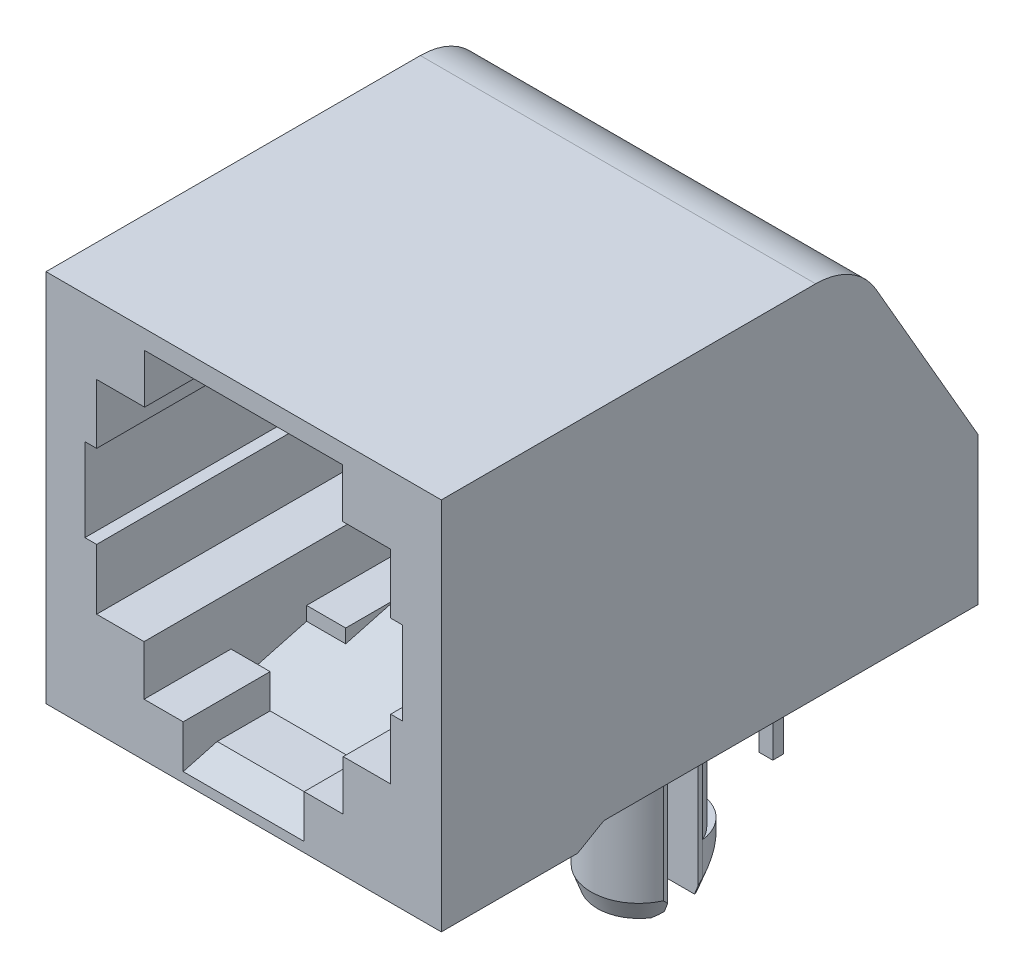
from build123d import *
from OCP.BRepFilletAPI import BRepFilletAPI_MakeChamfer

# Parameters (mm, degrees)
CUT_EXTRUDE1_START       = -5.7785
CUT_EXTRUDE1_OUTLINE_W   = 11.5824
CUT_EXTRUDE1_OUTLINE_H   = 18.034
CUT_EXTRUDE1_DEPTH       = 12.065
CUT_EXTRUDE1_START_2     = -9.7917
CUT_EXTRUDE1_2_DEPTH     = 4.0132
CUT_EXTRUDE1_START_3     = 15.205152132
CUT_EXTRUDE1_3_OUTLINE_W = 11.5824
CUT_EXTRUDE1_3_OUTLINE_H = 11
CUT_EXTRUDE1_3_DEPTH     = 4.794847868
CUT_EXTRUDE2_DEPTH       = 4.064
CUT_EXTRUDE3_DEPTH       = 1.31445
CUT_EXTRUDE4_DEPTH       = 1.31445
SKETCH5_W                = 2.921
SKETCH5_H                = 1.143
CUT_EXTRUDE5_DEPTH       = 4.064
SKETCH6_W                = 6.6929
SKETCH6_H                = 12.7762
CUT_EXTRUDE6_DEPTH       = 2.8194
SKETCH7_W                = 8.28675
SKETCH7_H                = 12.7762
CUT_EXTRUDE7_DEPTH       = 2.3876
SKETCH8_W                = 9.8806
SKETCH8_H                = 12.7762
CUT_EXTRUDE8_DEPTH       = 3.302
SKETCH9_W                = 11.5824
SKETCH9_H                = 5.461
BOSS_EXTRUDE1_DEPTH      = 0.508
BOSS_EXTRUDE2_DEPTH      = 1.7018
SKETCH11_W               = 0.762
SKETCH11_H               = 1.778
CUT_EXTRUDE9_DEPTH       = 0.381
SKETCH12_W               = 0.762
SKETCH12_H               = 1.778
CUT_EXTRUDE10_DEPTH      = 0.381
BOSS_EXTRUDE3_REACH      = 26
BOSS_EXTRUDE4_REACH      = 26
SKETCH15_W               = 1.59385
SKETCH15_H               = 3.5306
CUT_EXTRUDE11_DEPTH      = 9.6774
SKETCH16_W               = 1.59385
SKETCH16_H               = 3.0988
CUT_EXTRUDE12_DEPTH      = 2.3876
SKETCH17_W               = 1.59385
SKETCH17_H               = 1.143
CUT_EXTRUDE13_DEPTH      = 9.6774
BOSS_EXTRUDE5_DEPTH      = 4.2418
SKETCH19_W               = 6.6548
SKETCH19_H               = 4.6736
BOSS_EXTRUDE6_DEPTH      = 1.524
SKETCH20_W               = 6.6548
SKETCH20_H               = 3.3274
CUT_EXTRUDE14_DEPTH      = 1.651
SKETCH21_W               = 9.6774
SKETCH21_H               = 2.794
CUT_EXTRUDE15_DEPTH      = 0.3937
SKETCH22_W               = 9.6774
SKETCH22_H               = 2.794
CUT_EXTRUDE16_DEPTH      = 0.3937
SKETCH23_W               = 0.4572
SKETCH23_H               = 0.3556
BOSS_EXTRUDE7_DEPTH      = 4.318
SKETCH24_W               = 0.4572
SKETCH24_H               = 0.3556
BOSS_EXTRUDE8_DEPTH      = 4.318
SKETCH25_W               = 0.4572
SKETCH25_H               = 0.3556
BOSS_EXTRUDE9_DEPTH      = 4.318
SKETCH26_W               = 0.4572
SKETCH26_H               = 0.3556
BOSS_EXTRUDE10_DEPTH     = 4.318
SKETCH27_W               = 0.4572
SKETCH27_H               = 0.3556
BOSS_EXTRUDE11_DEPTH     = 4.318
SKETCH28_W               = 0.4572
SKETCH28_H               = 0.3556
BOSS_EXTRUDE12_DEPTH     = 4.318
DRAFT1_ANGLE             = 60
RIB1_START               = -0.2286
RIB1_DEPTH               = 0.4572
RIB2_START               = -0.2286
RIB2_DEPTH               = 0.4572
RIB3_START               = -0.2286
RIB3_DEPTH               = 0.4572
RIB4_START               = -0.2286
RIB4_DEPTH               = 0.4572
RIB5_START               = -0.2286
RIB5_DEPTH               = 0.4572
RIB6_START               = -0.2286
RIB6_DEPTH               = 0.4572
CHAMFER1_SIZE            = 0.146646968
CHAMFER1_SIZE2           = 0.254
CHAMFER2_SIZE            = 1.143
CHAMFER2_SIZE2           = 0.306265927
FILLET1_R                = 2.3368


with BuildPart() as part:
    # Cut-Extrude1: read off the stored shape, not the designer's step
    # Cut-Extrude1 outline → Cut-Extrude1 (new body)
    with BuildSketch(Plane(origin=(0, 0, 0), x_dir=(1, 0, 0), z_dir=(0, 1, 0)).offset(CUT_EXTRUDE1_START)):
        with Locations((0.8509, 9.017)):
            Rectangle(CUT_EXTRUDE1_OUTLINE_W, CUT_EXTRUDE1_OUTLINE_H)
    extrude(amount=CUT_EXTRUDE1_DEPTH)

    # Cut-Extrude1 2 outline → Cut-Extrude1 2 (add)
    with BuildSketch(Plane(origin=(0, 0, 0), x_dir=(1, 0, 0), z_dir=(0, 1, 0)).offset(CUT_EXTRUDE1_START_2)):
        with BuildLine():
            Line((-3.6068, 7.6962), (-6.5532, 7.6962))
            Line((-6.5532, 7.6962), (-6.5532, 7.54759649))
            ThreePointArc((-6.5532, 7.54759649), (-5.08, 6.5913), (-3.6068, 7.54759649))
            Line((-3.6068, 7.54759649), (-3.6068, 7.6962))
        make_face()
        with BuildLine():
            ThreePointArc((-3.6068, 8.86080351), (-5.08, 9.8171), (-6.5532, 8.86080351))
            Line((-6.5532, 8.86080351), (-6.5532, 8.7122))
            Line((-6.5532, 8.7122), (-3.6068, 8.7122))
            Line((-3.6068, 8.7122), (-3.6068, 8.86080351))
        make_face()
        with BuildLine():
            Line((3.6068, 8.86080351), (3.6068, 8.7122))
            Line((3.6068, 8.7122), (6.5532, 8.7122))
            Line((6.5532, 8.7122), (6.5532, 8.86080351))
            ThreePointArc((6.5532, 8.86080351), (5.08, 9.8171), (3.6068, 8.86080351))
        make_face()
        with BuildLine():
            Line((6.5532, 7.54759649), (6.5532, 7.6962))
            Line((6.5532, 7.6962), (3.6068, 7.6962))
            Line((3.6068, 7.6962), (3.6068, 7.54759649))
            ThreePointArc((3.6068, 7.54759649), (5.08, 6.5913), (6.5532, 7.54759649))
        make_face()
    extrude(amount=CUT_EXTRUDE1_2_DEPTH)

    # Cut-Extrude1 3 outline → Cut-Extrude1 3 (cut)
    with BuildSketch(Plane(origin=(0, 0, 0), x_dir=(1, 0, 0), z_dir=(0, 0.500000000000017, -0.8660254037844289)).offset(CUT_EXTRUDE1_START_3)):
        with Locations((0.8509, 5.5)):
            Rectangle(CUT_EXTRUDE1_3_OUTLINE_W, CUT_EXTRUDE1_3_OUTLINE_H)
    extrude(amount=CUT_EXTRUDE1_3_DEPTH, mode=Mode.SUBTRACT)

    # Cut-Extrude1 4 outline → Cut-Extrude1 4 (revolve, cut)
    with BuildSketch(Plane(origin=(5.08, 0, -8.2042), x_dir=(1, 0, 0), z_dir=(0, 0, 1))):
        Polygon((1.6129, -9.198519625), (1.396999946, -9.791700147), (1.6129, -9.791700147), align=None)
    revolve(axis=Axis((5.08, 0, -8.2042), (0, 1, 0)), mode=Mode.SUBTRACT)

    # Cut-Extrude1 5 outline → Cut-Extrude1 5 (revolve, cut)
    with BuildSketch(Plane(origin=(-5.08, 0, -8.2042), x_dir=(1, 0, 0), z_dir=(0, 0, 1))):
        Polygon((1.6129, -9.198519625), (1.396999946, -9.791700147), (1.6129, -9.791700147), align=None)
    revolve(axis=Axis((-5.08, 0, -8.2042), (0, 1, 0)), mode=Mode.SUBTRACT)

    # Sketch2 → Cut-Extrude2 (cut)
    with BuildSketch(Plane(origin=(2.032, 0, 0), x_dir=(0, 0, -1), z_dir=(1, 0, 0))):
        Polygon((7.186734073, -4.5085), (2.921, -4.5085), (2.921, -5.6515), align=None)
    extrude(amount=-CUT_EXTRUDE2_DEPTH, mode=Mode.SUBTRACT)

    # Sketch3 → Cut-Extrude3 (cut)
    with BuildSketch(Plane.ZY.offset(-2.032)):
        Polygon((-2.921, -4.5085), (-5.461, -4.5085), (-5.461, -4.970909051), (-2.921, -5.6515), align=None)
    extrude(amount=-CUT_EXTRUDE3_DEPTH, mode=Mode.SUBTRACT)

    # Sketch4 → Cut-Extrude4 (cut)
    with BuildSketch(Plane(origin=(-2.032, 0, 0), x_dir=(0, 0, -1), z_dir=(1, 0, 0))):
        Polygon((5.461, -4.5085), (2.921, -4.5085), (2.921, -5.6515), (5.461, -4.970909051), align=None)
    extrude(amount=-CUT_EXTRUDE4_DEPTH, mode=Mode.SUBTRACT)

    # Sketch5 → Cut-Extrude5 (cut)
    with BuildSketch(Plane(origin=(2.032, 0, 0), x_dir=(0, 0, -1), z_dir=(1, 0, 0))):
        with Locations((1.4605, -5.08)):
            Rectangle(SKETCH5_W, SKETCH5_H)
    extrude(amount=-CUT_EXTRUDE5_DEPTH, mode=Mode.SUBTRACT)

    # Sketch6 → Cut-Extrude6 (cut)
    with BuildSketch(Plane.XZ.offset(4.5085)):
        with Locations((0, -6.3881)):
            Rectangle(SKETCH6_W, SKETCH6_H)
    extrude(amount=-CUT_EXTRUDE6_DEPTH, mode=Mode.SUBTRACT)

    # Sketch7 → Cut-Extrude7 (cut)
    with BuildSketch(Plane.XZ.offset(1.6891)):
        with Locations((-0.796925, -6.3881)):
            Rectangle(SKETCH7_W, SKETCH7_H)
    extrude(amount=-CUT_EXTRUDE7_DEPTH, mode=Mode.SUBTRACT)

    # Sketch8 → Cut-Extrude8 (cut)
    with BuildSketch(Plane.XZ.offset(-0.6985)):
        with Locations((0, -6.3881)):
            Rectangle(SKETCH8_W, SKETCH8_H)
    extrude(amount=-CUT_EXTRUDE8_DEPTH, mode=Mode.SUBTRACT)

    # Sketch9 → Boss-Extrude1 (add)
    with BuildSketch(Plane.XZ.offset(5.7785)):
        with Locations((0.8509, -2.7305)):
            Rectangle(SKETCH9_W, SKETCH9_H)
    extrude(amount=BOSS_EXTRUDE1_DEPTH)

    # Sketch10 → Boss-Extrude2 (add)
    with BuildSketch(Plane.ZY.offset(4.9403)):
        Polygon((0, -6.2865), (-5.461, -6.2865), (-5.461, -5.7785), (-18.034, -5.7785), (-18.034, -0.8255), (-13.927884886, 6.2865), (0, 6.2865), align=None)
    extrude(amount=BOSS_EXTRUDE2_DEPTH)

    # Sketch11 → Cut-Extrude9 (cut)
    with BuildSketch(Plane.XY.offset(-12.7762)):
        with Locations((4.5593, 1.5875)):
            Rectangle(SKETCH11_W, SKETCH11_H)
    extrude(amount=-CUT_EXTRUDE9_DEPTH, mode=Mode.SUBTRACT)

    # Sketch12 → Cut-Extrude10 (cut)
    with BuildSketch(Plane.XY.offset(-12.7762)):
        with Locations((-4.5593, 1.5875)):
            Rectangle(SKETCH12_W, SKETCH12_H)
    extrude(amount=-CUT_EXTRUDE10_DEPTH, mode=Mode.SUBTRACT)

    # Boss-Extrude3: up to this cone (the profile starts inside it)
    boss_extrude3_end = Plane(origin=(5.08, -8.0899, -8.2042), z_dir=(0, 1, 0)).offset(-5.540024955) * Cone(1e-06, 12.395526987, 34.0564295, align=(Align.CENTER, Align.CENTER, Align.MIN), mode=Mode.PRIVATE)
    # Sketch13 → Boss-Extrude3 (add, up to the surface)
    with BuildSketch(Plane(origin=(0, -8.0899, 0), x_dir=(1, 0, 0), z_dir=(0, 1, 0)), mode=Mode.PRIVATE) as boss_extrude3_sk1:
        with BuildLine():
            ThreePointArc((6.543319155, 8.88253875), (5.08, 10.1854), (3.616680845, 8.88253875))
            ThreePointArc((3.616680845, 8.88253875), (5.08, 9.8171), (6.543319155, 8.88253875))
        make_face()
    boss_extrude3_tool1 = extrude(boss_extrude3_sk1.sketch, amount=-BOSS_EXTRUDE3_REACH, mode=Mode.PRIVATE) & boss_extrude3_end
    add(boss_extrude3_tool1.solids().sort_by_distance((5.08, -8.0899, -10.153365))[0])

    # Boss-Extrude4: up to this cone (the profile starts inside it)
    boss_extrude4_end = Plane(origin=(-5.08, -8.0899, -8.2042), z_dir=(0, 1, 0)).offset(-5.540024955) * Cone(1e-06, 12.395526987, 34.0564295, align=(Align.CENTER, Align.CENTER, Align.MIN), mode=Mode.PRIVATE)
    # Sketch14 → Boss-Extrude4 (add, up to the surface)
    with BuildSketch(Plane(origin=(0, -8.0899, 0), x_dir=(1, 0, 0), z_dir=(0, 1, 0)), mode=Mode.PRIVATE) as boss_extrude4_sk1:
        with BuildLine():
            ThreePointArc((-6.543319155, 8.88253875), (-5.08, 9.8171), (-3.616680845, 8.88253875))
            ThreePointArc((-3.616680845, 8.88253875), (-5.08, 10.1854), (-6.543319155, 8.88253875))
        make_face()
    boss_extrude4_tool1 = extrude(boss_extrude4_sk1.sketch, amount=-BOSS_EXTRUDE4_REACH, mode=Mode.PRIVATE) & boss_extrude4_end
    add(boss_extrude4_tool1.solids().sort_by_distance((-5.08, -8.0899, -10.153365))[0])

    # Sketch15 → Cut-Extrude11 (cut)
    with BuildSketch(Plane.XY):
        with Locations((4.143375, -1.0668)):
            Rectangle(SKETCH15_W, SKETCH15_H)
    extrude(amount=-CUT_EXTRUDE11_DEPTH, mode=Mode.SUBTRACT)

    # Sketch16 → Cut-Extrude12 (cut)
    with BuildSketch(Plane(origin=(0, 0.6985, 0), x_dir=(-1, 0, 0), z_dir=(0, 1, 0))):
        with Locations((-4.143375, -11.2268)):
            Rectangle(SKETCH16_W, SKETCH16_H)
    extrude(amount=-CUT_EXTRUDE12_DEPTH, mode=Mode.SUBTRACT)

    # Sketch17 → Cut-Extrude13 (cut)
    with BuildSketch(Plane.XY):
        with Locations((-4.143375, -2.2606)):
            Rectangle(SKETCH17_W, SKETCH17_H)
    extrude(amount=-CUT_EXTRUDE13_DEPTH, mode=Mode.SUBTRACT)

    # Sketch18 → Boss-Extrude5 (add)
    with BuildSketch(Plane.XY.offset(-8.7122)):
        with BuildLine():
            Line((0.508, -5.7785), (-0.508, -5.7785))
            ThreePointArc((-0.508, -5.7785), (0, -6.2865), (0.508, -5.7785))
        make_face()
    extrude(amount=-BOSS_EXTRUDE5_DEPTH)

    # Sketch19 → Boss-Extrude6 (add)
    with BuildSketch(Plane.XY.offset(-12.7762)):
        with Locations((0, 1.6637)):
            Rectangle(SKETCH19_W, SKETCH19_H)
    extrude(amount=BOSS_EXTRUDE6_DEPTH)

    # Sketch20 → Cut-Extrude14 (cut)
    with BuildSketch(Plane.XZ.offset(-4.0005)):
        with Locations((0, -1.6637)):
            Rectangle(SKETCH20_W, SKETCH20_H)
    extrude(amount=-CUT_EXTRUDE14_DEPTH, mode=Mode.SUBTRACT)

    # Sketch21 → Cut-Extrude15 (cut)
    with BuildSketch(Plane.ZY.offset(-4.9403)):
        with Locations((-4.8387, 0.5969)):
            Rectangle(SKETCH21_W, SKETCH21_H)
    extrude(amount=-CUT_EXTRUDE15_DEPTH, mode=Mode.SUBTRACT)

    # Sketch22 → Cut-Extrude16 (cut)
    with BuildSketch(Plane(origin=(-4.9403, 0, 0), x_dir=(0, 0, -1), z_dir=(1, 0, 0))):
        with Locations((4.8387, 0.5969)):
            Rectangle(SKETCH22_W, SKETCH22_H)
    extrude(amount=-CUT_EXTRUDE16_DEPTH, mode=Mode.SUBTRACT)

    # Sketch23 → Boss-Extrude7 (add)
    with BuildSketch(Plane.XZ.offset(5.7785)):
        with Locations((-3.175, -17.0942)):
            Rectangle(SKETCH23_W, SKETCH23_H)
    extrude(amount=BOSS_EXTRUDE7_DEPTH)

    # Sketch24 → Boss-Extrude8 (add)
    with BuildSketch(Plane.XZ.offset(5.7785)):
        with Locations((-1.905, -14.5542)):
            Rectangle(SKETCH24_W, SKETCH24_H)
    extrude(amount=BOSS_EXTRUDE8_DEPTH)

    # Sketch25 → Boss-Extrude9 (add)
    with BuildSketch(Plane.XZ.offset(5.7785)):
        with Locations((-0.635, -17.0942)):
            Rectangle(SKETCH25_W, SKETCH25_H)
    extrude(amount=BOSS_EXTRUDE9_DEPTH)

    # Sketch26 → Boss-Extrude10 (add)
    with BuildSketch(Plane.XZ.offset(5.7785)):
        with Locations((0.635, -14.5542)):
            Rectangle(SKETCH26_W, SKETCH26_H)
    extrude(amount=BOSS_EXTRUDE10_DEPTH)

    # Sketch27 → Boss-Extrude11 (add)
    with BuildSketch(Plane.XZ.offset(5.7785)):
        with Locations((1.905, -17.0942)):
            Rectangle(SKETCH27_W, SKETCH27_H)
    extrude(amount=BOSS_EXTRUDE11_DEPTH)

    # Sketch28 → Boss-Extrude12 (add)
    with BuildSketch(Plane.XZ.offset(5.7785)):
        with Locations((3.175, -14.5542)):
            Rectangle(SKETCH28_W, SKETCH28_H)
    extrude(amount=BOSS_EXTRUDE12_DEPTH)

    # Draft1
    draft1_faces = [part.faces().sort_by_distance(p)[0] for p in [
        (0, -6.0325, -5.461),
    ]]
    draft(draft1_faces, Plane(origin=(-6.6421, -5.7785, -5.461), x_dir=(0, 0, -1), z_dir=(0, -1, 0)), DRAFT1_ANGLE)

    # Rib1: read off the stored shape, not the designer's step
    # Rib1 outline → Rib1 (add)
    with BuildSketch(Plane(origin=(0.508, 0, 0), x_dir=(0, -1, 0), z_dir=(-1, 0, 0)).offset(RIB1_START)):
        Polygon((-4.0005, -6.172623327), (-2.815249541, -8.484849417), (-1.396701604, -11.2522), (-0.997104618, -11.2522), (-4.0005, -5.393076212), align=None)
    extrude(amount=RIB1_DEPTH)

    # Rib2: read off the stored shape, not the designer's step
    # Rib2 outline → Rib2 (add)
    with BuildSketch(Plane(origin=(-0.508, 0, 0), x_dir=(0, -1, 0), z_dir=(-1, 0, 0)).offset(RIB2_START)):
        Polygon((-4.0005, -6.172623327), (-2.815249541, -8.484849417), (-1.396701604, -11.2522), (-0.997104618, -11.2522), (-4.0005, -5.393076212), align=None)
    extrude(amount=RIB2_DEPTH)

    # Rib3: read off the stored shape, not the designer's step
    # Rib3 outline → Rib3 (add)
    with BuildSketch(Plane(origin=(-1.524, 0, 0), x_dir=(0, -1, 0), z_dir=(-1, 0, 0)).offset(RIB3_START)):
        Polygon((-4.0005, -6.172623327), (-2.815249541, -8.484849417), (-1.396701604, -11.2522), (-0.997104618, -11.2522), (-4.0005, -5.393076212), align=None)
    extrude(amount=RIB3_DEPTH)

    # Rib4: read off the stored shape, not the designer's step
    # Rib4 outline → Rib4 (add)
    with BuildSketch(Plane(origin=(-2.54, 0, 0), x_dir=(0, -1, 0), z_dir=(-1, 0, 0)).offset(RIB4_START)):
        Polygon((-4.0005, -6.172623327), (-2.815249541, -8.484849417), (-1.396701604, -11.2522), (-0.997104618, -11.2522), (-4.0005, -5.393076212), align=None)
    extrude(amount=RIB4_DEPTH)

    # Rib5: read off the stored shape, not the designer's step
    # Rib5 outline → Rib5 (add)
    with BuildSketch(Plane(origin=(2.54, 0, 0), x_dir=(0, -1, 0), z_dir=(-1, 0, 0)).offset(RIB5_START)):
        Polygon((-4.0005, -6.172623327), (-2.815249541, -8.484849417), (-1.396701604, -11.2522), (-0.997104618, -11.2522), (-4.0005, -5.393076212), align=None)
    extrude(amount=RIB5_DEPTH)

    # Rib6: read off the stored shape, not the designer's step
    # Rib6 outline → Rib6 (add)
    with BuildSketch(Plane(origin=(1.524, 0, 0), x_dir=(0, -1, 0), z_dir=(-1, 0, 0)).offset(RIB6_START)):
        Polygon((-4.0005, -6.172623327), (-2.815249541, -8.484849417), (-1.396701604, -11.2522), (-0.997104618, -11.2522), (-4.0005, -5.393076212), align=None)
    extrude(amount=RIB6_DEPTH)

    # Chamfer1: one chamfer whose edges measure the first distance from different faces: ONE call of the kernel's chamfer builder (chamfer() names one face for all edges)
    chamfer1_edges_1 = [part.edges().sort_by_distance(p)[0] for p in [
        (5.08, -9.7917, -7.6962),
    ]]
    chamfer1_side_1 = [part.faces().sort_by_distance(p)[0] for p in [
        (5.08, -7.773077548, -7.6962),
    ]]
    chamfer1_edges_2 = [part.edges().sort_by_distance(p)[0] for p in [
        (-5.08, -9.7917, -8.7122),
    ]]
    chamfer1_side_2 = [part.faces().sort_by_distance(p)[0] for p in [
        (-5.08, -7.773077548, -8.7122),
    ]]
    chamfer1_edges_3 = [part.edges().sort_by_distance(p)[0] for p in [
        (5.08, -9.7917, -8.7122),
    ]]
    chamfer1_side_3 = [part.faces().sort_by_distance(p)[0] for p in [
        (5.08, -7.773077548, -8.7122),
    ]]
    chamfer1_edges_4 = [part.edges().sort_by_distance(p)[0] for p in [
        (-5.08, -9.7917, -7.6962),
    ]]
    chamfer1_side_4 = [part.faces().sort_by_distance(p)[0] for p in [
        (-5.08, -7.773077548, -7.6962),
    ]]
    chamfer1 = BRepFilletAPI_MakeChamfer(part.part.solid().wrapped)
    for e in chamfer1_edges_1:
        chamfer1.Add(CHAMFER1_SIZE, CHAMFER1_SIZE2, e.wrapped, chamfer1_side_1[0].wrapped)  # the first distance lies on this face
    for e in chamfer1_edges_2:
        chamfer1.Add(CHAMFER1_SIZE, CHAMFER1_SIZE2, e.wrapped, chamfer1_side_2[0].wrapped)  # the first distance lies on this face
    for e in chamfer1_edges_3:
        chamfer1.Add(CHAMFER1_SIZE, CHAMFER1_SIZE2, e.wrapped, chamfer1_side_3[0].wrapped)  # the first distance lies on this face
    for e in chamfer1_edges_4:
        chamfer1.Add(CHAMFER1_SIZE, CHAMFER1_SIZE2, e.wrapped, chamfer1_side_4[0].wrapped)  # the first distance lies on this face
    add(Compound.cast(chamfer1.Shape()), mode=Mode.REPLACE)

    # Chamfer2
    chamfer2_edges = [part.edges().sort_by_distance(p)[0] for p in [
        (0, -5.6515, 0),
    ]]
    chamfer2_side = [part.faces().sort_by_distance(p)[0] for p in [
        (0, -5.6515, -1.4605),
    ]]
    chamfer(chamfer2_edges, length=CHAMFER2_SIZE, length2=CHAMFER2_SIZE2, reference=chamfer2_side[0])

    # Fillet1
    fillet1_edges = [part.edges().sort_by_distance(p)[0] for p in [
        (0.8509, 6.2865, -13.927884886),
    ]]
    fillet(fillet1_edges, radius=FILLET1_R)


solid = part.part
